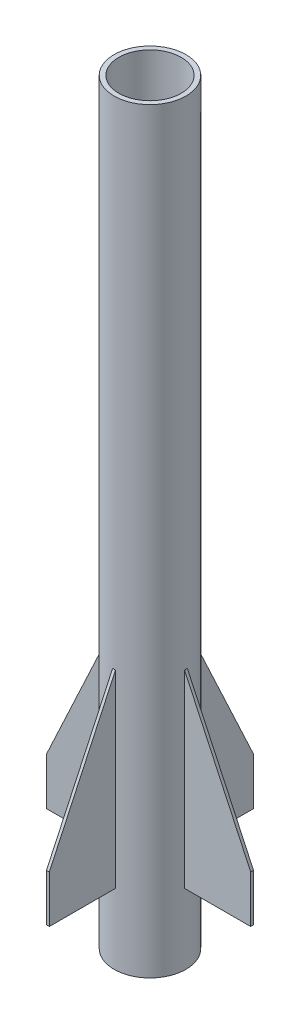
from build123d import *

# Parameters (mm, degrees)
SKETCH1_W                = 10
SKETCH1_H                = 1600
BOSS_EXTRUDE1_DEPTH      = 3
BOSS_EXTRUDE1_DEPTH_BACK = 3
CIRPATTERN2_COUNT        = 4


with BuildPart() as part:
    # Sketch1 → Revolve1 (revolve)
    with BuildSketch(Plane.XY):
        with Locations((71, 800)):
            Rectangle(SKETCH1_W, SKETCH1_H)
    revolve(axis=Axis((0, 0, 0), (0, 1, 0)))


with BuildPart() as body_2:
    # Sketch2 → Boss-Extrude1 (new, two sides: drawn at the far end of the back side and taken through both)
    with BuildSketch(Plane.XY.offset(-BOSS_EXTRUDE1_DEPTH_BACK)):
        Polygon((-76, 550), (-76, 150), (-216, 150), (-216, 250), align=None)
    extrude(amount=BOSS_EXTRUDE1_DEPTH + BOSS_EXTRUDE1_DEPTH_BACK)


with BuildPart() as cirpattern2_1:
    # CirPattern2: pattern copy
    add(body_2.part.rotate(Axis((0, 0, 0), (0, 1, 0)), 1 * 360 / CIRPATTERN2_COUNT))


with BuildPart() as cirpattern2_2:
    # CirPattern2: pattern copy
    add(body_2.part.rotate(Axis((0, 0, 0), (0, 1, 0)), 2 * 360 / CIRPATTERN2_COUNT))


with BuildPart() as cirpattern2_3:
    # CirPattern2: pattern copy
    add(body_2.part.rotate(Axis((0, 0, 0), (0, 1, 0)), 3 * 360 / CIRPATTERN2_COUNT))


solid = Compound([part.part, body_2.part, cirpattern2_1.part, cirpattern2_2.part, cirpattern2_3.part])
